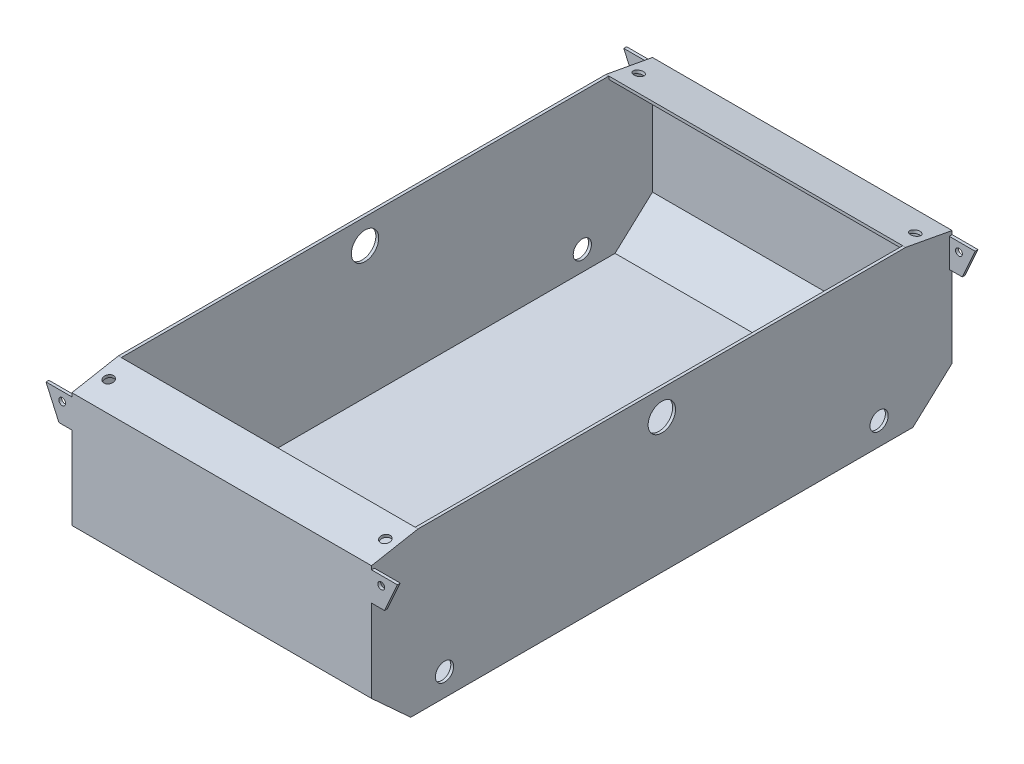
from build123d import *

# Parameters (mm, degrees)
ESQUISSE1_W             = 208.5
ESQUISSE1_H             = 111
BOSS_EXTRU_1_DEPTH      = 404
ESQUISSE3_W             = 18
ESQUISSE3_H             = 400
ENL_V_MAT_EXTRU_2_DEPTH = 475.36747359
ENL_V_MAT_EXTRU_3_DEPTH = 477.276442835
COQUE2_START            = 2
COQUE2_DEPTH            = 204.5
ENL_V_MAT_EXTRU_4_REACH = 478.276
ESQUISSE5_W             = 204.5
ESQUISSE5_H             = 339.253793908
D_GAGEMENT_1_41_D       = 6.7564
D_GAGEMENT_1_41_DEPTH   = 2
D_GAGEMENT_1_42_D       = 6.7564
D_GAGEMENT_1_42_DEPTH   = 2
ESQUISSE10_R            = 9.525
ESQUISSE10_R_2          = 6.35
ENL_V_MAT_EXTRU_5_DEPTH = 477.276442835
ENL_V_MAT_EXTRU_6_REACH = 478.276
ESQUISSE11_R            = 2.38125
ENL_V_MAT_EXTRU_7_REACH = 478.276
ESQUISSE12_R            = 2.38125


# Read off the part's stored shape, not the designer's step: Coque2
with BuildPart() as part:
    # Esquisse1 → Boss.-Extru.1 (new body)
    with BuildSketch(Plane.XY):
        with Locations((104.25, 55.5)):
            Rectangle(ESQUISSE1_W, ESQUISSE1_H)
        Polygon((0, 102.5), (-18, 102.5), (-9, 82.5), (0, 82.5), align=None)
        Polygon((208.5, 102.5), (226.5, 102.5), (217.5, 82.5), (208.5, 82.5), align=None)
    extrude(amount=-BOSS_EXTRU_1_DEPTH)

    # Esquisse3 → Enlèv. mat.-Extru.2 (cut, through all)
    with BuildSketch(Plane(origin=(0, 102.5, 0), x_dir=(1, 0, 0), z_dir=(0, 1, 0))):
        with Locations((-9, 202)):
            Rectangle(ESQUISSE3_W, ESQUISSE3_H)
        with Locations((217.5, 202)):
            Rectangle(ESQUISSE3_W, ESQUISSE3_H)
    extrude(amount=-ENL_V_MAT_EXTRU_2_DEPTH, mode=Mode.SUBTRACT)

    # Esquisse4 → Enlèv. mat.-Extru.3 (cut, through all)
    with BuildSketch(Plane.ZY):
        Polygon((0, 105), (-32.373103046, 111), (0, 111), align=None)
        Polygon((-404, 105), (-371.626896954, 111), (-404, 111), align=None)
        Polygon((0, 25), (-27.276363394, 0), (0, 0), align=None)
        Polygon((-404, 25), (-376.723636606, 0), (-404, 0), align=None)
    extrude(amount=-ENL_V_MAT_EXTRU_3_DEPTH, mode=Mode.SUBTRACT)

    # Coque2 outline → Coque2 (cut)
    with BuildSketch(Plane.YZ.offset(COQUE2_START)):
        Polygon((25.87988269, -402), (103.336617558, -402), (109, -371.443122771), (109, -32.556877229), (103.336617558, -2), (25.87988269, -2), (2, -28.054254322), (2, -375.945745678), align=None)
    extrude(amount=COQUE2_DEPTH, mode=Mode.SUBTRACT)

    # Esquisse5 → Enlèv. mat.-Extru.4 (cut, up to next)
    with BuildSketch(Plane(origin=(0, 111, 0), x_dir=(1, 0, 0), z_dir=(0, 1, 0)), mode=Mode.PRIVATE) as enl_v_mat_extru_4_sk1:
        with Locations((104.25, 202)):
            Rectangle(ESQUISSE5_W, ESQUISSE5_H)
    enl_v_mat_extru_4_tool1 = extrude(enl_v_mat_extru_4_sk1.sketch, amount=-ENL_V_MAT_EXTRU_4_REACH, mode=Mode.PRIVATE) & part.part
    add(enl_v_mat_extru_4_tool1.solids().sort_by_distance((104.25, 111, -202))[0], mode=Mode.SUBTRACT)

    # Dégagement 1/41
    with Locations(Plane(origin=(0, 101.512972391, 18.814317351), x_dir=(1, 0, 0), z_dir=(0, 0.983254907563956, 0.18223552549214056))):
        with Locations((8, 37.059155773), (200.5, 37.059155773)):
            Hole(D_GAGEMENT_1_41_D / 2, depth=D_GAGEMENT_1_41_DEPTH)

    # Dégagement 1/42
    with Locations(Plane(origin=(0, 173.903298199, -32.231071199), x_dir=(1, 0, 0), z_dir=(0, 0.983254907563956, -0.18223552549214078))):
        with Locations((8, 360.175826883), (200.5, 360.175826883)):
            Hole(D_GAGEMENT_1_42_D / 2, depth=D_GAGEMENT_1_42_DEPTH)

    # Esquisse10 → Enlèv. mat.-Extru.5 (cut, through all)
    with BuildSketch(Plane.ZY):
        with Locations((-202, 93.525)):
            Circle(ESQUISSE10_R)
        with Locations((-353.2, 15.75)):
            Circle(ESQUISSE10_R_2)
        with Locations((-50.8, 15.75)):
            Circle(ESQUISSE10_R_2)
    extrude(amount=-ENL_V_MAT_EXTRU_5_DEPTH, mode=Mode.SUBTRACT)

    # Esquisse11 → Enlèv. mat.-Extru.6 (cut, up to next)
    with BuildSketch(Plane.XY, mode=Mode.PRIVATE) as enl_v_mat_extru_6_sk1:
        with Locations((-6.74, 96.27)):
            Circle(ESQUISSE11_R)
    enl_v_mat_extru_6_tool1 = extrude(enl_v_mat_extru_6_sk1.sketch, amount=-ENL_V_MAT_EXTRU_6_REACH, mode=Mode.PRIVATE) & part.part
    # Esquisse11 → Enlèv. mat.-Extru.6 (cut, up to next)
    with BuildSketch(Plane.XY, mode=Mode.PRIVATE) as enl_v_mat_extru_6_sk2:
        with Locations((215.24, 96.27)):
            Circle(ESQUISSE11_R)
    enl_v_mat_extru_6_tool2 = extrude(enl_v_mat_extru_6_sk2.sketch, amount=-ENL_V_MAT_EXTRU_6_REACH, mode=Mode.PRIVATE) & part.part
    add(enl_v_mat_extru_6_tool1.solids().sort_by_distance((-6.74, 96.27, 0))[0], mode=Mode.SUBTRACT)
    add(enl_v_mat_extru_6_tool2.solids().sort_by_distance((215.24, 96.27, 0))[0], mode=Mode.SUBTRACT)

    # Esquisse12 → Enlèv. mat.-Extru.7 (cut, up to next)
    with BuildSketch(Plane(origin=(0, 0, -404), x_dir=(-1, 0, 0), z_dir=(0, 0, -1)), mode=Mode.PRIVATE) as enl_v_mat_extru_7_sk1:
        with Locations(Location((-215.24, 96.27, 0), (0, 0, 180))):
            Circle(ESQUISSE12_R)
    enl_v_mat_extru_7_tool1 = extrude(enl_v_mat_extru_7_sk1.sketch, amount=-ENL_V_MAT_EXTRU_7_REACH, mode=Mode.PRIVATE) & part.part
    # Esquisse12 → Enlèv. mat.-Extru.7 (cut, up to next)
    with BuildSketch(Plane(origin=(0, 0, -404), x_dir=(-1, 0, 0), z_dir=(0, 0, -1)), mode=Mode.PRIVATE) as enl_v_mat_extru_7_sk2:
        with Locations(Location((6.74, 96.27, 0), (0, 0, 180))):
            Circle(ESQUISSE12_R)
    enl_v_mat_extru_7_tool2 = extrude(enl_v_mat_extru_7_sk2.sketch, amount=-ENL_V_MAT_EXTRU_7_REACH, mode=Mode.PRIVATE) & part.part
    add(enl_v_mat_extru_7_tool1.solids().sort_by_distance((215.24, 96.27, -404))[0], mode=Mode.SUBTRACT)
    add(enl_v_mat_extru_7_tool2.solids().sort_by_distance((-6.74, 96.27, -404))[0], mode=Mode.SUBTRACT)


solid = part.part
